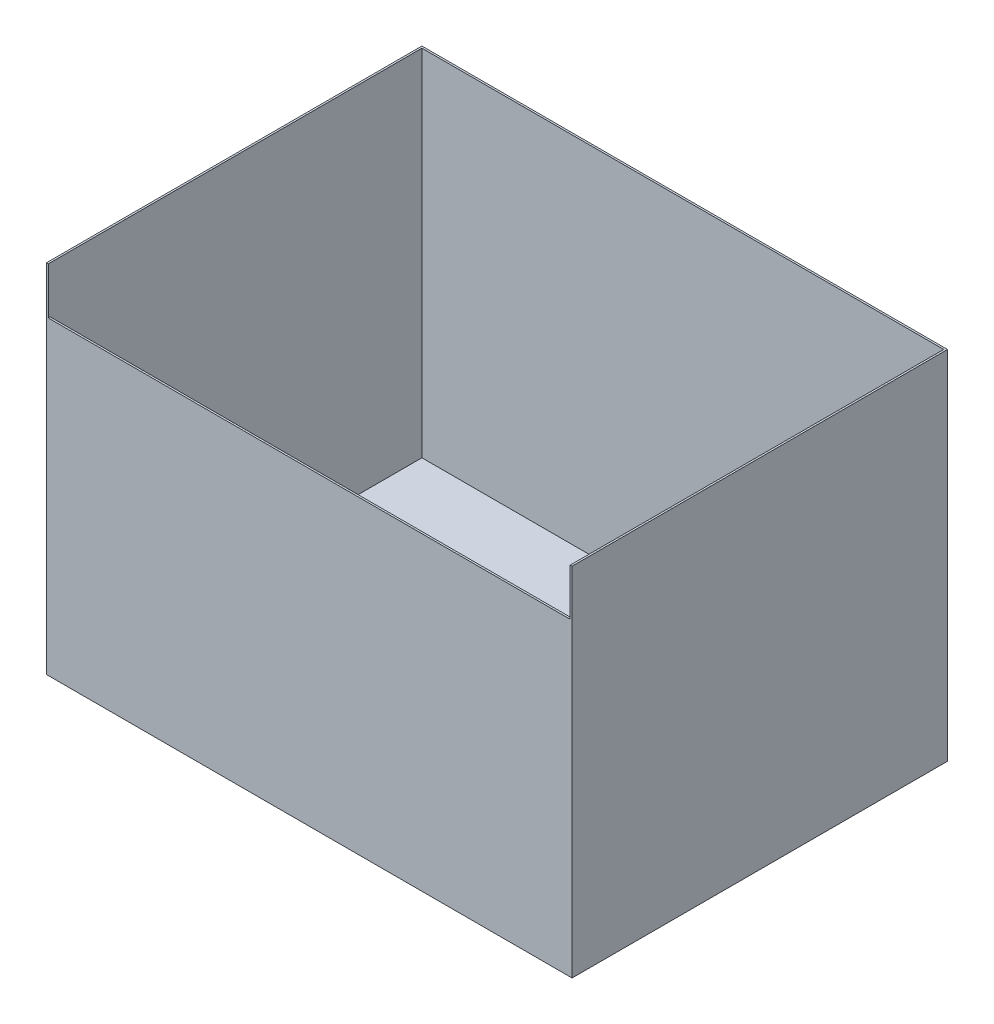
from build123d import *

# Parameters (mm, degrees)
SKETCH1_W           = 711.2
SKETCH1_H           = 508
BOSS_EXTRUDE1_DEPTH = 241.3
SHELL1_T            = -2.54
CUT_EXTRUDE1_REACH  = 667.388
SKETCH2_W           = 706.12
SKETCH2_H           = 63.5


with BuildPart() as part:
    # Sketch1 → Boss-Extrude1 (new, symmetric)
    with BuildSketch(Plane(origin=(0, 0, 0), x_dir=(1, 0, 0), z_dir=(0, 1, 0))):
        Rectangle(SKETCH1_W, SKETCH1_H)
    extrude(amount=BOSS_EXTRUDE1_DEPTH, both=True)

    # Shell1
    shell1_openings = [part.faces().sort_by_distance(p)[0] for p in [
        (0, 241.3, 0),
    ]]
    offset(amount=SHELL1_T, openings=shell1_openings, kind=Kind.INTERSECTION)

    # Sketch2 → Cut-Extrude1 (cut, up to next)
    with BuildSketch(Plane.XY.offset(254), mode=Mode.PRIVATE) as cut_extrude1_sk1:
        with Locations((0, 209.55)):
            Rectangle(SKETCH2_W, SKETCH2_H)
    cut_extrude1_tool1 = extrude(cut_extrude1_sk1.sketch, amount=-CUT_EXTRUDE1_REACH, mode=Mode.PRIVATE) & part.part
    add(cut_extrude1_tool1.solids().sort_by_distance((0, 209.55, 254))[0], mode=Mode.SUBTRACT)


solid = part.part
